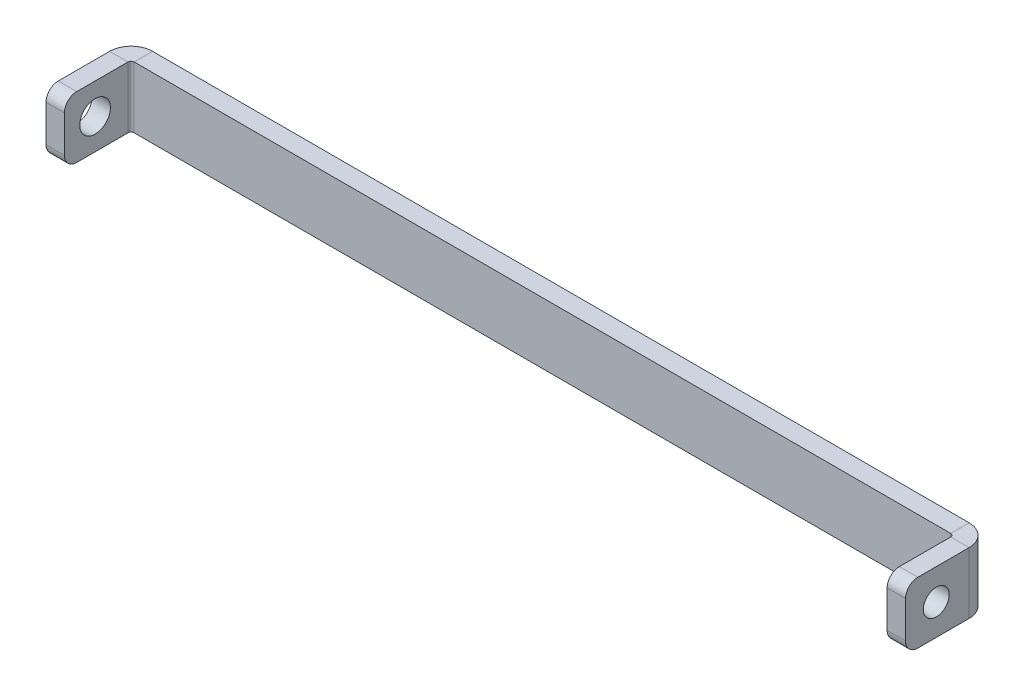
from build123d import *

# Parameters (mm, degrees)
SKETCH_1_R             = 2.5
SKETCH_1_R_2           = 2
SM_BASE_FLANGE_1_DEPTH = 3
OTHER_START            = 78.048031103
OTHER_1_OUTLINE_R      = 2.5
OTHER_1_OUTLINE_R_2    = 2
OTHER_1_DEPTH          = 3
OTHER_START_2          = -68.951968897
OTHER_1_2_OUTLINE_W    = 10
OTHER_1_2_OUTLINE_H    = 3
OTHER_1_2_DEPTH        = 10
OTHER_START_3          = 81.048031103
OTHER_1_3_OUTLINE_W    = 10
OTHER_1_3_OUTLINE_H    = 3
OTHER_1_3_DEPTH        = 10
OTHER_START_4          = -58.951968897
OTHER_1_4_OUTLINE_R    = 2.5
OTHER_1_4_DEPTH        = 3.5
OTHER_START_5          = 77.548031103
OTHER_1_5_OUTLINE_R    = 2.5
OTHER_1_5_DEPTH        = 3.5
OTHER_START_6          = 13
OTHER_1_6_DEPTH        = 12
HOLE_WIZARD_M5_1_D     = 4.2


with BuildPart() as part:
    # 基体-法兰1: sheet metal written as solids
    # Sketch 1 → 基体-法兰1 (new body)
    with BuildSketch(Plane.XY):
        with BuildLine():
            Line((-66.951968897, 24.322862815), (89.048031103, 24.322862815))
            ThreePointArc((89.048031103, 24.322862815), (90.462244666, 23.737076377), (91.048031103, 22.322862815))
            Line((91.048031103, 22.322862815), (91.048031103, 16.322862815))
            ThreePointArc((91.048031103, 16.322862815), (90.462244666, 14.908649252), (89.048031103, 14.322862815))
            Line((89.048031103, 14.322862815), (-66.951968897, 14.322862815))
            ThreePointArc((-66.951968897, 14.322862815), (-68.366182459, 14.908649252), (-68.951968897, 16.322862815))
            Line((-68.951968897, 16.322862815), (-68.951968897, 22.322862815))
            ThreePointArc((-68.951968897, 22.322862815), (-68.366182459, 23.737076377), (-66.951968897, 24.322862815))
        make_face()
        with Locations((-63.951968897, 19.322862815)):
            Circle(SKETCH_1_R, mode=Mode.SUBTRACT)
        with Locations((86.048031103, 19.322862815)):
            Circle(SKETCH_1_R_2, mode=Mode.SUBTRACT)
    extrude(amount=-SM_BASE_FLANGE_1_DEPTH)

    # Other 1 2 outline → Other 1 2 (cut)
    with BuildSketch(Plane.YZ.offset(OTHER_START_2)):
        with Locations((19.322862815, -1.5)):
            Rectangle(OTHER_1_2_OUTLINE_W, OTHER_1_2_OUTLINE_H)
    extrude(amount=OTHER_1_2_DEPTH, mode=Mode.SUBTRACT)

    # Other 1 3 outline → Other 1 3 (cut)
    with BuildSketch(Plane.YZ.offset(OTHER_START_3)):
        with Locations((19.322862815, -1.5)):
            Rectangle(OTHER_1_3_OUTLINE_W, OTHER_1_3_OUTLINE_H)
    extrude(amount=OTHER_1_3_DEPTH, mode=Mode.SUBTRACT)

    # Other 1 4 outline → Other 1 4 (add)
    with BuildSketch(Plane.YZ.offset(OTHER_START_4)):
        with BuildLine():
            Line((14.322862815, 0), (24.322862815, 0))
            Line((24.322862815, 0), (24.322862815, 8.858407346))
            ThreePointArc((24.322862815, 8.858407346), (23.737076378, 10.272620909), (22.322862815, 10.858407346))
            Line((22.322862815, 10.858407346), (16.322862815, 10.858407346))
            ThreePointArc((16.322862815, 10.858407346), (14.908649252, 10.272620909), (14.322862815, 8.858407346))
            Line((14.322862815, 8.858407346), (14.322862815, 0))
        make_face()
        with Locations((19.322862815, 5.858407346)):
            Circle(OTHER_1_4_OUTLINE_R, mode=Mode.SUBTRACT)
    extrude(amount=OTHER_1_4_DEPTH)



with BuildPart() as body_2:
    # Other 1: read off the stored shape, not the designer's step
    # Other 1 outline → Other 1 (new body)
    with BuildSketch(Plane.YZ.offset(OTHER_START)):
        with Locations((19.322862815, 5.858407346)):
            Circle(OTHER_1_OUTLINE_R)
        with Locations((19.322862815, 5.858407346)):
            Circle(OTHER_1_OUTLINE_R_2, mode=Mode.SUBTRACT)
    extrude(amount=OTHER_1_DEPTH)


with BuildPart() as part_1:
    add(part.part)

    add(body_2.part)  # Other 1 5 merges body 2
    # Other 1 5 outline → Other 1 5 (add)
    with BuildSketch(Plane.YZ.offset(OTHER_START_5)):
        with BuildLine():
            Line((14.322862815, 0), (24.322862815, 0))
            Line((24.322862815, 0), (24.322862815, 8.858407346))
            ThreePointArc((24.322862815, 8.858407346), (23.737076378, 10.272620909), (22.322862815, 10.858407346))
            Line((22.322862815, 10.858407346), (16.322862815, 10.858407346))
            ThreePointArc((16.322862815, 10.858407346), (14.908649252, 10.272620909), (14.322862815, 8.858407346))
            Line((14.322862815, 8.858407346), (14.322862815, 0))
        make_face()
        with Locations((19.322862815, 5.858407346)):
            Circle(OTHER_1_5_OUTLINE_R, mode=Mode.SUBTRACT)
    extrude(amount=OTHER_1_5_DEPTH)

    # Other 1 6 outline → Other 1 6 (cut)
    with BuildSketch(Plane(origin=(0, 0, 0), x_dir=(1, 0, 0), z_dir=(0, 1, 0)).offset(OTHER_START_6)):
        with BuildLine():
            Line((-55.951968897, -0.5), (-55.951968897, -10.858407346))
            Line((-55.951968897, -10.858407346), (-55.451968897, -10.858407346))
            Line((-55.451968897, -10.858407346), (-55.451968897, 0))
            ThreePointArc((-55.451968897, 0), (-55.805522288, -0.146446609), (-55.951968897, -0.5))
        make_face()
        with BuildLine():
            Line((77.548031103, -10.858407346), (78.048031103, -10.858407346))
            Line((78.048031103, -10.858407346), (78.048031103, -0.5))
            ThreePointArc((78.048031103, -0.5), (77.901584494, -0.146446609), (77.548031103, 0))
            Line((77.548031103, 0), (77.548031103, -10.858407346))
        make_face()
        with BuildLine():
            Line((81.048031103, 3), (77.548031103, 3))
            ThreePointArc((77.548031103, 3), (80.022904837, 1.974873734), (81.048031103, -0.5))
            Line((81.048031103, -0.5), (81.048031103, 3))
        make_face()
        with BuildLine():
            ThreePointArc((-58.951968897, -0.5), (-57.926842631, 1.974873734), (-55.451968897, 3))
            Line((-55.451968897, 3), (-58.951968897, 3))
            Line((-58.951968897, 3), (-58.951968897, -0.5))
        make_face()
    extrude(amount=OTHER_1_6_DEPTH, mode=Mode.SUBTRACT)

    # M5 螺纹孔1 (through all)
    with Locations(Plane(origin=(81.048031103, 0, 0), x_dir=(0, 0, -1), z_dir=(1, 0, 0))):
        with Locations((-5.858407346, 19.322862815)):
            Hole(HOLE_WIZARD_M5_1_D / 2)


solid = part_1.part
